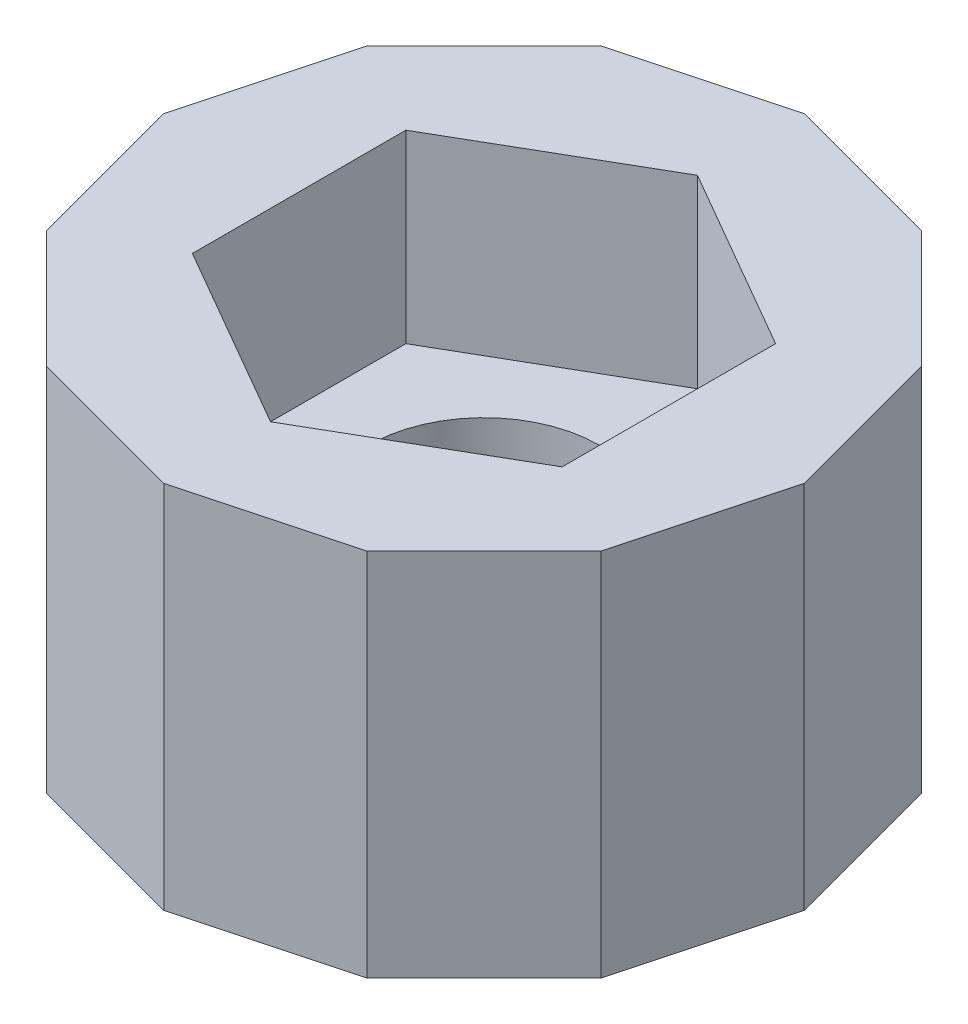
from build123d import *

# Parameters (mm, degrees)
RESSALTO_EXTRUS_O1_DEPTH = 8
ESBO_O1_3_R              = 2.5
RESSALTO_EXTRUS_O2_DEPTH = 4


with BuildPart() as part:
    # Esboço1 → Ressalto-extrusão1 (new body)
    with BuildSketch(Plane(origin=(0, 0, 0), x_dir=(1, 0, 0), z_dir=(0, 1, 0))):
        Polygon((3.464101615, 6), (0, 6.92820323), (-3.464101615, 6), (-6, 3.464101615), (-6.92820323, 0), (-6, -3.464101615), (-3.464101615, -6), (0, -6.92820323), (3.464101615, -6), (6, -3.464101615), (6.92820323, 0), (6, 3.464101615), align=None)
        Polygon((0, 4.618802154), (4, 2.309401077), (4, -2.309401077), (0, -4.618802154), (-4, -2.309401077), (-4, 2.309401077), align=None, mode=Mode.SUBTRACT)
    extrude(amount=RESSALTO_EXTRUS_O1_DEPTH)

    # Esboço1<3> → Ressalto-extrusão2 (add)
    with BuildSketch(Plane(origin=(0, 0, 0), x_dir=(1, 0, 0), z_dir=(0, 1, 0))):
        Polygon((4, 2.309401077), (0, 4.618802154), (-4, 2.309401077), (-4, -2.309401077), (0, -4.618802154), (4, -2.309401077), align=None)
        Circle(ESBO_O1_3_R, mode=Mode.SUBTRACT)
    extrude(amount=RESSALTO_EXTRUS_O2_DEPTH)


solid = part.part
